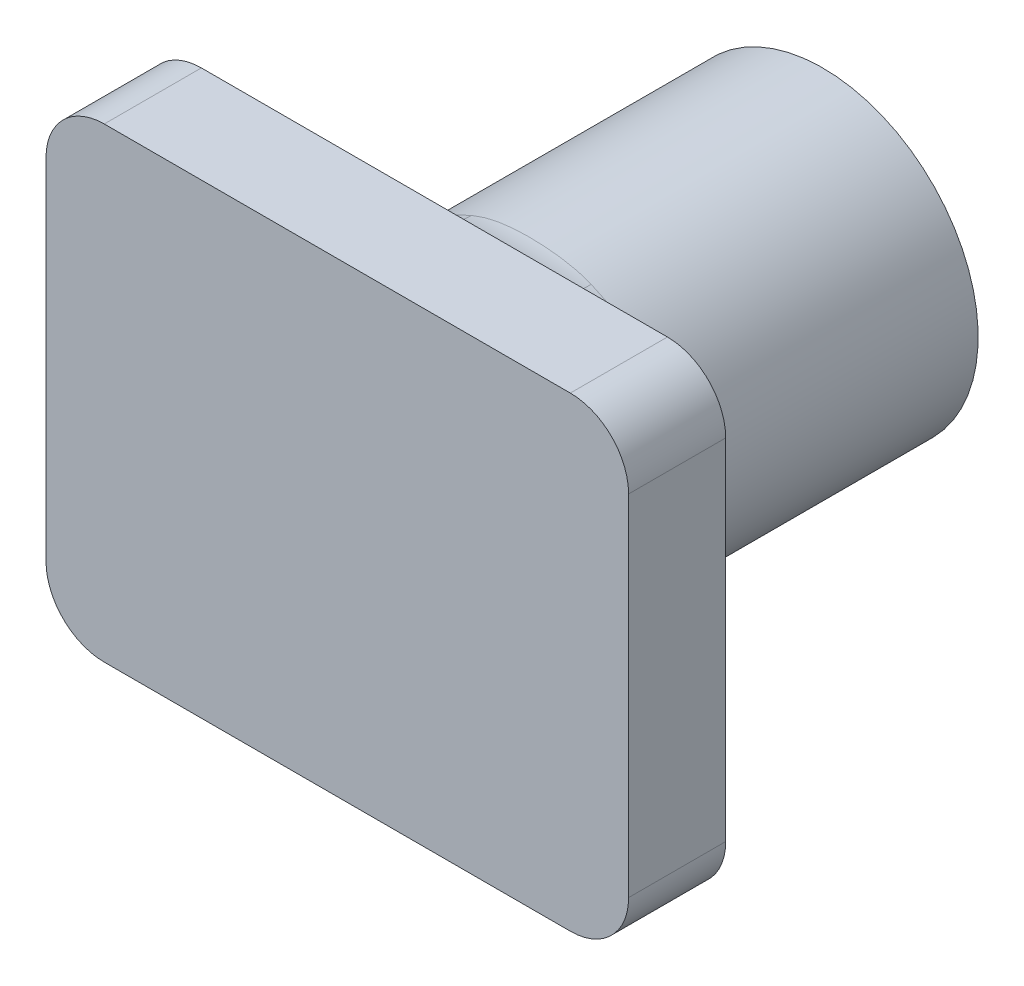
from build123d import *

# Parameters (mm, degrees)
SKETCH1_W           = 30
SKETCH1_H           = 24
BOSS_EXTRUDE1_DEPTH = 5
SKETCH3_R           = 8
SKETCH3_R_2         = 5.1
BOSS_EXTRUDE3_DEPTH = 20
FILLET5_R           = 3
FILLET6_R           = 5


with BuildPart() as part:
    # Sketch1 → Boss-Extrude1 (new body)
    with BuildSketch(Plane.XY):
        Rectangle(SKETCH1_W, SKETCH1_H)
    extrude(amount=BOSS_EXTRUDE1_DEPTH)

    # Sketch3 → Boss-Extrude3 (add)
    with BuildSketch(Plane(origin=(0, 0, 0), x_dir=(-1, 0, 0), z_dir=(0, 0, -1))):
        Circle(SKETCH3_R)
        Circle(SKETCH3_R_2, mode=Mode.SUBTRACT)
    extrude(amount=BOSS_EXTRUDE3_DEPTH)

    # Fillet5
    fillet5_edges = [part.edges().sort_by_distance(p)[0] for p in [
        (-15, 12, 2.5),
        (-15, -12, 2.5),
        (15, -12, 2.5),
        (15, 12, 2.5),
    ]]
    fillet(fillet5_edges, radius=FILLET5_R)

    # Fillet6
    fillet6_edges = [part.edges().sort_by_distance(p)[0] for p in [
        (8, 0, 0),
    ]]
    fillet(fillet6_edges, radius=FILLET6_R)


solid = part.part
